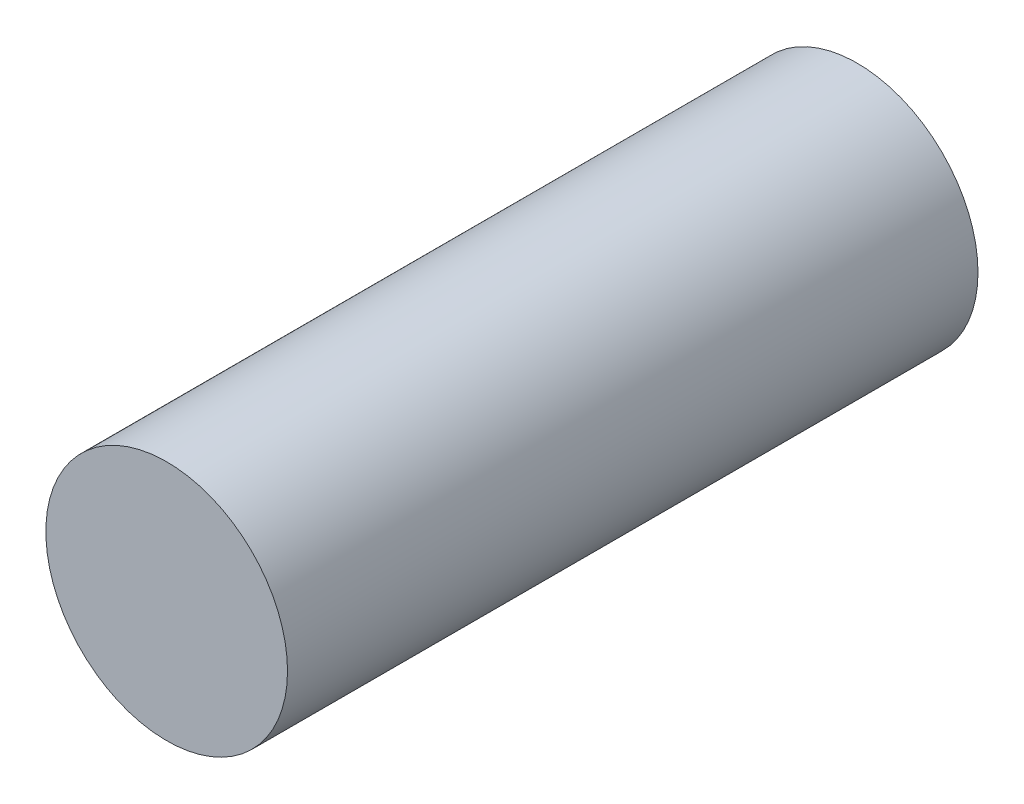
from build123d import *

# Parameters (mm, degrees)
SKETCH1_R           = 3.1115
BOSS_EXTRUDE1_DEPTH = 17.78


with BuildPart() as part:
    # Sketch1 → Boss-Extrude1 (new body)
    with BuildSketch(Plane.XY):
        Circle(SKETCH1_R)
    extrude(amount=BOSS_EXTRUDE1_DEPTH)


solid = part.part
